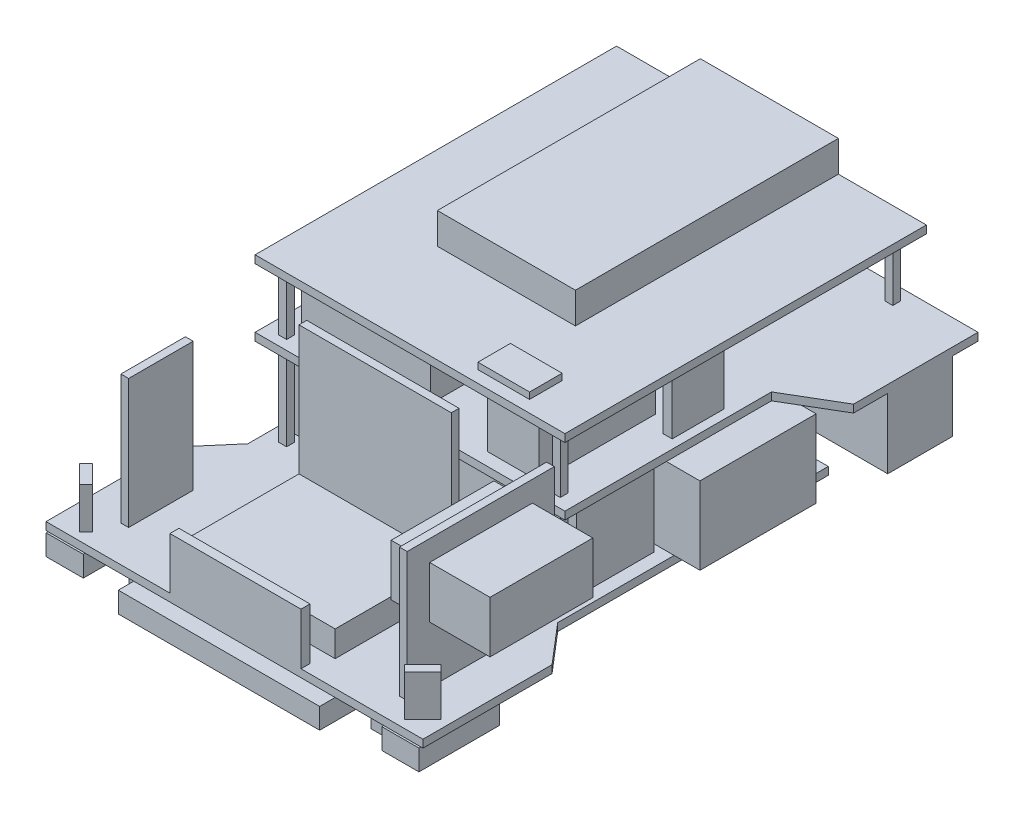
from build123d import *

# Parameters (mm, degrees)
BOSS_EXTRUDE1_DEPTH       = 3
SKETCH2_W                 = 3.05
SKETCH2_H                 = 3.05
BOSS_EXTRUDE2_DEPTH       = 33
BOSS_EXTRUDE3_DEPTH       = 3
SKETCH4_W                 = 3.05
SKETCH4_H                 = 3.05
BOSS_EXTRUDE4_DEPTH       = 23
SKETCH6_W                 = 120
SKETCH6_H                 = 140
BOSS_EXTRUDE5_DEPTH       = 3
SKETCH7_W                 = 68
SKETCH7_H                 = 25
BOSS_EXTRUDE6_DEPTH       = 27
SKETCH9_W                 = 58
SKETCH9_H                 = 60
SKETCH9_W_2               = 20
SKETCH9_H_2               = 45
SKETCH9_W_3               = 50
SKETCH9_H_3               = 30
BOSS_EXTRUDE7_DEPTH       = 20
SKETCH10_W                = 53.46
SKETCH10_H                = 101.85
BOSS_EXTRUDE8_DEPTH       = 12
SKETCH11_W                = 110
SKETCH11_H                = 30
BOSS_EXTRUDE9_DEPTH       = 32
SKETCH12_W                = 140
SKETCH12_H                = 45
BOSS_EXTRUDE10_DEPTH      = 30
SKETCH13_W                = 20
SKETCH13_H                = 12.6
BOSS_EXTRUDE11_DEPTH      = 2.5
SKETCH14_W                = 3.6
SKETCH14_H                = 20
BOSS_EXTRUDE12_DEPTH      = 20
BOSS_EXTRUDE13_DEPTH      = 16
SKETCH16_W                = 3
SKETCH16_H                = 57
SKETCH16_H_2              = 25
BOSS_EXTRUDE14_DEPTH      = 50
BOSS_EXTRUDE15_DEPTH      = 23.4
BOSS_EXTRUDE15_DEPTH_BACK = 14.9
SKETCH17_W                = 39.808487161
SKETCH17_H                = 20
SKETCH18_W                = 78
SKETCH18_H                = 25
SKETCH18_W_2              = 14.4
SKETCH18_H_2              = 31.3
BOSS_EXTRUDE16_DEPTH      = 8
SKETCH20_W                = 10
SKETCH20_H                = 10
BOSS_EXTRUDE18_DEPTH      = 14.56
SKETCH21_W                = 8
SKETCH21_H                = 8
CUT_EXTRUDE1_DEPTH        = 5
SKETCH22_W                = 50.76
SKETCH22_H                = 3.5
BOSS_EXTRUDE19_DEPTH      = 20
SKETCH23_W                = 59
SKETCH23_H                = 47.99
BOSS_EXTRUDE20_DEPTH      = 10
SKETCH24_W                = 59
SKETCH24_H                = 3
BOSS_EXTRUDE21_DEPTH      = 50


with BuildPart() as part:
    # Sketch1 → Boss-Extrude1 (new body)
    with BuildSketch(Plane(origin=(0, 0, 0), x_dir=(1, 0, 0), z_dir=(0, 1, 0))):
        Polygon((-73, -35), (-60, -19.801315846), (-60, 85), (60, 85), (60, -19.801315846), (73, -35), (73, -85), (60, -85), (-60, -85), (-73, -85), align=None)
    extrude(amount=BOSS_EXTRUDE1_DEPTH)

    # Sketch2 → Boss-Extrude2 (add)
    with BuildSketch(Plane(origin=(0, 3, 0), x_dir=(1, 0, 0), z_dir=(0, 1, 0))):
        with Locations((-53, -11.81)):
            Rectangle(SKETCH2_W, SKETCH2_H)
        with Locations((53, -11.81)):
            Rectangle(SKETCH2_W, SKETCH2_H)
        with Locations((54, 75)):
            Rectangle(SKETCH2_W, SKETCH2_H)
        with Locations((-54, 75)):
            Rectangle(SKETCH2_W, SKETCH2_H)
    extrude(amount=BOSS_EXTRUDE2_DEPTH)

    # Sketch3 → Boss-Extrude3 (add)
    with BuildSketch(Plane(origin=(0, 36, 0), x_dir=(1, 0, 0), z_dir=(0, 1, 0))):
        Polygon((-60, 62.99), (-60, -17.01), (60, -17.01), (60, 62.99), (80, 74.780305915), (80, 122.99), (-80, 122.99), (-80, 74.780305915), align=None)
    extrude(amount=BOSS_EXTRUDE3_DEPTH)

    # Sketch4 → Boss-Extrude4 (add)
    with BuildSketch(Plane(origin=(0, 39, 0), x_dir=(1, 0, 0), z_dir=(0, 1, 0))):
        with Locations((-53, -11.81)):
            Rectangle(SKETCH4_W, SKETCH4_H)
        with Locations((-53, 116.99)):
            Rectangle(SKETCH4_W, SKETCH4_H)
        with Locations((53, -11.81)):
            Rectangle(SKETCH4_W, SKETCH4_H)
        with Locations((53, 116.99)):
            Rectangle(SKETCH4_W, SKETCH4_H)
    extrude(amount=BOSS_EXTRUDE4_DEPTH)

    # Sketch6 → Boss-Extrude5 (add)
    with BuildSketch(Plane(origin=(0, 62, 0), x_dir=(1, 0, 0), z_dir=(0, 1, 0))):
        with Locations((0, 52.99)):
            Rectangle(SKETCH6_W, SKETCH6_H)
    extrude(amount=BOSS_EXTRUDE5_DEPTH)

    # Sketch7 → Boss-Extrude6 (add)
    with BuildSketch(Plane.XZ.offset(-36)):
        with Locations((-46, -100.53)):
            Rectangle(SKETCH7_W, SKETCH7_H)
        with Locations((46, -100.53)):
            Rectangle(SKETCH7_W, SKETCH7_H)
    extrude(amount=BOSS_EXTRUDE6_DEPTH)

    # Sketch9 → Boss-Extrude7 (add)
    with BuildSketch(Plane(origin=(0, 39, 0), x_dir=(1, 0, 0), z_dir=(0, 1, 0))):
        with Locations((-1.05, 85.88)):
            Rectangle(SKETCH9_W, SKETCH9_H)
        with Locations((35, 10.49)):
            Rectangle(SKETCH9_W_2, SKETCH9_H_2)
        with Locations((-27, 7.99)):
            Rectangle(SKETCH9_W_3, SKETCH9_H_3)
    extrude(amount=BOSS_EXTRUDE7_DEPTH)

    # Sketch10 → Boss-Extrude8 (add)
    with BuildSketch(Plane(origin=(0, 65, 0), x_dir=(1, 0, 0), z_dir=(0, 1, 0))):
        with Locations((-0.81, 72.065)):
            Rectangle(SKETCH10_W, SKETCH10_H)
    extrude(amount=BOSS_EXTRUDE8_DEPTH)

    # Sketch11 → Boss-Extrude9 (add)
    with BuildSketch(Plane(origin=(0, 3, 0), x_dir=(1, 0, 0), z_dir=(0, 1, 0))):
        with Locations((0, 7.543684861)):
            Rectangle(SKETCH11_W, SKETCH11_H)
    extrude(amount=BOSS_EXTRUDE9_DEPTH)

    # Sketch12 → Boss-Extrude10 (add)
    with BuildSketch(Plane(origin=(0, 3, 0), x_dir=(1, 0, 0), z_dir=(0, 1, 0))):
        with Locations((0, 47.793183731)):
            Rectangle(SKETCH12_W, SKETCH12_H)
    extrude(amount=BOSS_EXTRUDE10_DEPTH)

    # Sketch13 → Boss-Extrude11 (add)
    with BuildSketch(Plane(origin=(0, 65, 0), x_dir=(1, 0, 0), z_dir=(0, 1, 0))):
        with Locations((31.68, -6.09)):
            Rectangle(SKETCH13_W, SKETCH13_H)
    extrude(amount=BOSS_EXTRUDE11_DEPTH)

    # Sketch14 → Boss-Extrude12 (add)
    with BuildSketch(Plane(origin=(0, 39, 0), x_dir=(1, 0, 0), z_dir=(0, 1, 0))):
        with Locations((54.75, 37.99)):
            Rectangle(SKETCH14_W, SKETCH14_H)
        with Locations((-54.75, 37.99)):
            Rectangle(SKETCH14_W, SKETCH14_H)
    extrude(amount=BOSS_EXTRUDE12_DEPTH)

    # Sketch15 → Boss-Extrude13 (add)
    with BuildSketch(Plane(origin=(0, 3, 0), x_dir=(1, 0, 0), z_dir=(0, 1, 0))):
        Polygon((62.928932188, -82), (60.454058454, -79.525126266), (67.525126266, -72.454058454), (70, -74.928932188), align=None)
        Polygon((-70, -74.928932188), (-62.928932188, -82), (-60.454058454, -79.525126266), (-67.525126266, -72.454058454), align=None)
    extrude(amount=BOSS_EXTRUDE13_DEPTH)

    # Sketch16 → Boss-Extrude14 (add)
    with BuildSketch(Plane(origin=(0, 3, 0), x_dir=(1, 0, 0), z_dir=(0, 1, 0))):
        with Locations((55.5, -46.6)):
            Rectangle(SKETCH16_W, SKETCH16_H)
        with Locations((-56.5, -58.5)):
            Rectangle(SKETCH16_W, SKETCH16_H_2)
    extrude(amount=BOSS_EXTRUDE14_DEPTH)

    # Sketch17 → Boss-Extrude15 (add, two sides: drawn at the far end of the back side and taken through both)
    with BuildSketch(Plane(origin=(57, 0, 0), x_dir=(0, 0, -1), z_dir=(1, 0, 0)).offset(-BOSS_EXTRUDE15_DEPTH_BACK)):
        with Locations((-46.50705122, 35)):
            Rectangle(SKETCH17_W, SKETCH17_H)
    extrude(amount=BOSS_EXTRUDE15_DEPTH + BOSS_EXTRUDE15_DEPTH_BACK)

    # Sketch18 → Boss-Extrude16 (add)
    with BuildSketch(Plane.XZ):
        with Locations((0, 78.5)):
            Rectangle(SKETCH18_W, SKETCH18_H)
        with Locations((-65, 70.1)):
            Rectangle(SKETCH18_W_2, SKETCH18_H_2)
        with Locations((65, 70.1)):
            Rectangle(SKETCH18_W_2, SKETCH18_H_2)
    extrude(amount=BOSS_EXTRUDE16_DEPTH)

    # Sketch20 → Boss-Extrude18 (add)
    with BuildSketch(Plane.XZ):
        with Locations((-46.89, 69)):
            Rectangle(SKETCH20_W, SKETCH20_H)
        with Locations((46.89, 69)):
            Rectangle(SKETCH20_W, SKETCH20_H)
    extrude(amount=BOSS_EXTRUDE18_DEPTH)

    # Sketch21 → Cut-Extrude1 (cut)
    with BuildSketch(Plane.XZ.offset(14.56)):
        with Locations((46.89, 69)):
            Rectangle(SKETCH21_W, SKETCH21_H)
        with Locations((-46.89, 69)):
            Rectangle(SKETCH21_W, SKETCH21_H)
    extrude(amount=-CUT_EXTRUDE1_DEPTH, mode=Mode.SUBTRACT)

    # Sketch22 → Boss-Extrude19 (add)
    with BuildSketch(Plane(origin=(0, 3, 0), x_dir=(1, 0, 0), z_dir=(0, 1, 0))):
        with Locations((0.38, -83.25)):
            Rectangle(SKETCH22_W, SKETCH22_H)
    extrude(amount=BOSS_EXTRUDE19_DEPTH)

    # Sketch23 → Boss-Extrude20 (add)
    with BuildSketch(Plane(origin=(0, 3, 0), x_dir=(1, 0, 0), z_dir=(0, 1, 0))):
        with Locations((-0.5, -51.005)):
            Rectangle(SKETCH23_W, SKETCH23_H)
    extrude(amount=BOSS_EXTRUDE20_DEPTH)

    # Sketch24 → Boss-Extrude21 (add)
    with BuildSketch(Plane(origin=(0, 13, 0), x_dir=(1, 0, 0), z_dir=(0, 1, 0))):
        with Locations((-0.5, -28.51)):
            Rectangle(SKETCH24_W, SKETCH24_H)
    extrude(amount=BOSS_EXTRUDE21_DEPTH)


solid = part.part
